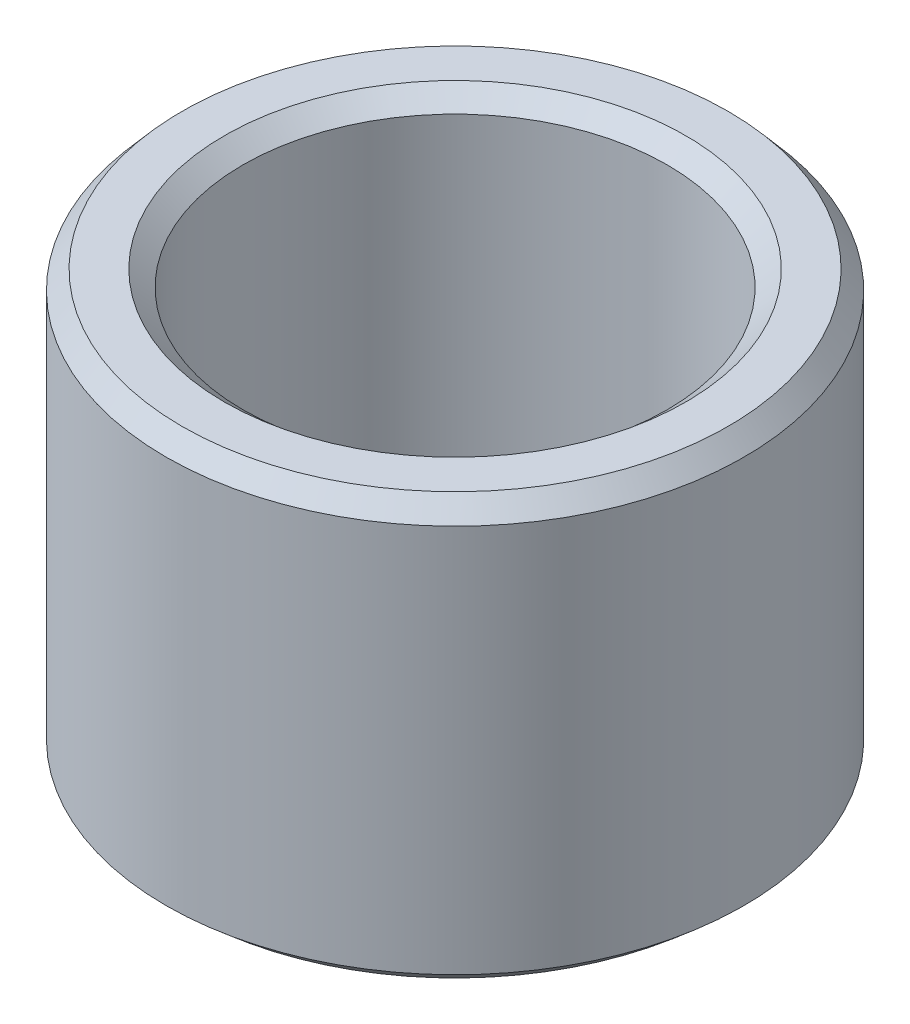
from build123d import *
from OCP.BRepFilletAPI import BRepFilletAPI_MakeChamfer

# Parameters (mm, degrees)
SKETCH1_R           = 55
BOSS_EXTRUDE1_DEPTH = 80.507622506
SKETCH2_R           = 40.378736041
CUT_EXTRUDE1_DEPTH  = 112.944081048
CHAMFER1_SIZE       = 3.535062968
CHAMFER1_SIZE2      = 3.041250281


with BuildPart() as part:
    # Sketch1 → Boss-Extrude1 (new body)
    with BuildSketch(Plane(origin=(0, 0, 0), x_dir=(1, 0, 0), z_dir=(0, 1, 0))):
        Circle(SKETCH1_R)
    extrude(amount=BOSS_EXTRUDE1_DEPTH)

    # Sketch2 → Cut-Extrude1 (cut, through all)
    with BuildSketch(Plane(origin=(0, 0, 0), x_dir=(1, 0, 0), z_dir=(0, 1, 0))):
        Circle(SKETCH2_R)
    extrude(amount=CUT_EXTRUDE1_DEPTH, mode=Mode.SUBTRACT)

    # Chamfer1: one chamfer whose edges measure the first distance from different faces: ONE call of the kernel's chamfer builder (chamfer() names one face for all edges)
    chamfer1_edges_1 = [part.edges().sort_by_distance(p)[0] for p in [
        (-40.378736041, 80.507622506, 0),
    ]]
    chamfer1_side_1 = [part.faces().sort_by_distance(p)[0] for p in [
        (-53.444365081, 80.507622506, 0),
    ]]
    chamfer1_edges_2 = [part.edges().sort_by_distance(p)[0] for p in [
        (-40.378736041, 0, 0),
    ]]
    chamfer1_side_2 = [part.faces().sort_by_distance(p)[0] for p in [
        (-40.378736041, 40.253811253, 0),
    ]]
    chamfer1_edges_3 = [part.edges().sort_by_distance(p)[0] for p in [
        (-55, 0, 0),
    ]]
    chamfer1_side_3 = [part.faces().sort_by_distance(p)[0] for p in [
        (-53.444365081, 0, 0),
    ]]
    chamfer1_edges_4 = [part.edges().sort_by_distance(p)[0] for p in [
        (-55, 80.507622506, 0),
    ]]
    chamfer1_side_4 = [part.faces().sort_by_distance(p)[0] for p in [
        (-55, 40.253811253, 0),
    ]]
    chamfer1 = BRepFilletAPI_MakeChamfer(part.part.solid().wrapped)
    for e in chamfer1_edges_1:
        chamfer1.Add(CHAMFER1_SIZE, CHAMFER1_SIZE2, e.wrapped, chamfer1_side_1[0].wrapped)  # the first distance lies on this face
    for e in chamfer1_edges_2:
        chamfer1.Add(CHAMFER1_SIZE, CHAMFER1_SIZE2, e.wrapped, chamfer1_side_2[0].wrapped)  # the first distance lies on this face
    for e in chamfer1_edges_3:
        chamfer1.Add(CHAMFER1_SIZE, CHAMFER1_SIZE2, e.wrapped, chamfer1_side_3[0].wrapped)  # the first distance lies on this face
    for e in chamfer1_edges_4:
        chamfer1.Add(CHAMFER1_SIZE, CHAMFER1_SIZE2, e.wrapped, chamfer1_side_4[0].wrapped)  # the first distance lies on this face
    add(Compound.cast(chamfer1.Shape()), mode=Mode.REPLACE)


solid = part.part
